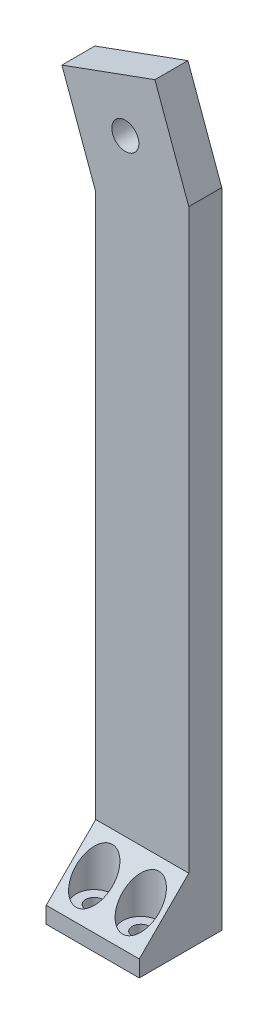
from build123d import *

# Parameters (mm, degrees)
SKETCH1_R           = 4.1
BOSS_EXTRUDE1_DEPTH = 10
SKETCH2_W           = 28.190778624
SKETCH2_H           = 5
BOSS_EXTRUDE2_DEPTH = 15
SKETCH4_R           = 2.6
CUT_EXTRUDE1_DEPTH  = 20
CHAMFER1_SIZE       = 15
SKETCH5_R           = 5.5
CUT_EXTRUDE2_DEPTH  = 20


with BuildPart() as part:
    # Sketch1 → Boss-Extrude1 (new body)
    with BuildSketch(Plane.XY):
        Polygon((535.624793848, 194.951481696), (535.624793848, 0), (507.434015224, 0), (507.434015224, 184.690877396), (497.173410925, 212.881656019), (525.364189548, 223.142260319), align=None)
        with Locations((516.399102386, 203.916568858)):
            Circle(SKETCH1_R, mode=Mode.SUBTRACT)
    extrude(amount=BOSS_EXTRUDE1_DEPTH)

    # Sketch2 → Boss-Extrude2 (add)
    with BuildSketch(Plane.XY.offset(10)):
        with Locations((521.529404536, 2.5)):
            Rectangle(SKETCH2_W, SKETCH2_H)
    extrude(amount=BOSS_EXTRUDE2_DEPTH)

    # Sketch4 → Cut-Extrude1 (cut)
    with BuildSketch(Plane(origin=(0, 5, 0), x_dir=(1, 0, 0), z_dir=(0, 1, 0))):
        with Locations(Location((528.577099192, -17.5, 0), (0, 0, 270))):
            Circle(SKETCH4_R)
        with Locations(Location((514.48170988, -17.5, 0), (0, 0, 270))):
            Circle(SKETCH4_R)
    extrude(amount=-CUT_EXTRUDE1_DEPTH, mode=Mode.SUBTRACT)

    # Chamfer1
    # the kernel refuses this chamfer: 15 mm, written as the material it adds along each edge
    with BuildSketch(Plane(origin=(535.624793848, 5, 10), x_dir=(0, 0.9996219169112968, -0.02749587661058632), z_dir=(-1, 0, 0))) as chamfer1_piece_1_section:
        Polygon((CHAMFER1_SIZE * 0.999621916911, -CHAMFER1_SIZE * 0.0274958766106), (-CHAMFER1_SIZE * 0.0274958766106, -CHAMFER1_SIZE * 0.999621916911), (0, 0), align=None)
    chamfer1_piece_1 = extrude(amount=28.190778624, mode=Mode.PRIVATE)
    chamfer1_piece_1 = split(chamfer1_piece_1, bisect_by=Plane(origin=(521.529400048, 10.087187588, 25), z_dir=(0, 0, -1)), keep=Keep.TOP, mode=Mode.PRIVATE)
    chamfer1_piece_1 = chamfer1_piece_1 - Plane(origin=(528.577099192, 10.087187588, 17.5), x_dir=(0, 0, 1), z_dir=(0, 1, 0)) * Cylinder(2.6, 117, mode=Mode.PRIVATE)
    chamfer1_piece_1 = chamfer1_piece_1 - Plane(origin=(514.48170988, 10.087187588, 17.5), x_dir=(0, 0, 1), z_dir=(0, 1, 0)) * Cylinder(2.6, 117, mode=Mode.PRIVATE)
    add(chamfer1_piece_1)

    # Sketch5 → Cut-Extrude2 (cut)
    with BuildSketch(Plane(origin=(0, 5, 0), x_dir=(1, 0, 0), z_dir=(0, 1, 0))):
        with Locations(Location((514.48170988, -17.5, 0), (0, 0, 270))):
            Circle(SKETCH5_R)
        with Locations(Location((528.577099192, -17.5, 0), (0, 0, 270))):
            Circle(SKETCH5_R)
    extrude(amount=CUT_EXTRUDE2_DEPTH, mode=Mode.SUBTRACT)


solid = part.part
